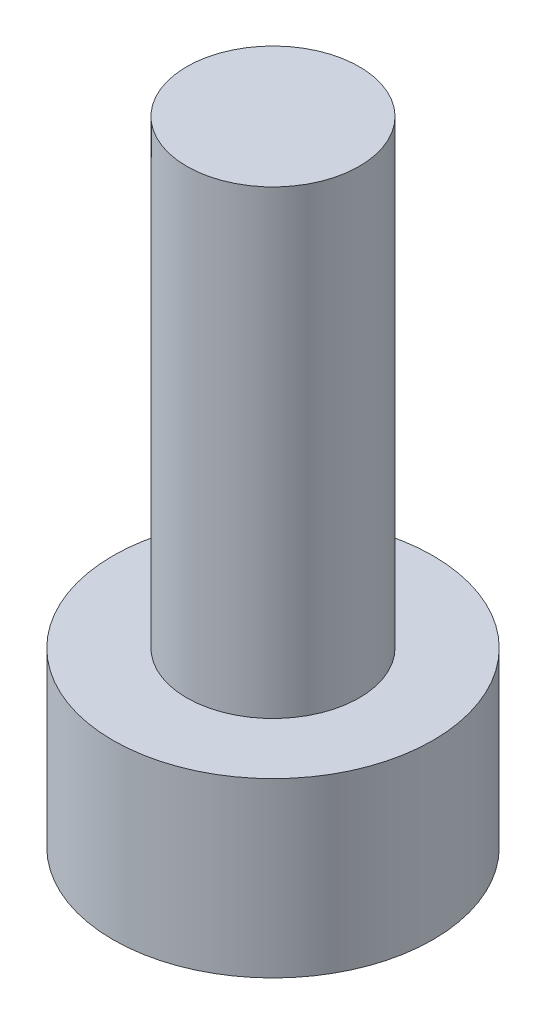
from build123d import *

# Parameters (mm, degrees)
SKETCH1_R           = 2.78
BOSS_EXTRUDE1_DEPTH = 3
SKETCH2_R           = 1.5
BOSS_EXTRUDE2_DEPTH = 8


with BuildPart() as part:
    # Sketch1 → Boss-Extrude1 (new body)
    with BuildSketch(Plane(origin=(0, 0, 0), x_dir=(1, 0, 0), z_dir=(0, 1, 0))):
        Circle(SKETCH1_R)
    extrude(amount=BOSS_EXTRUDE1_DEPTH)

    # Sketch2 → Boss-Extrude2 (add)
    with BuildSketch(Plane(origin=(0, 3, 0), x_dir=(1, 0, 0), z_dir=(0, 1, 0))):
        Circle(SKETCH2_R)
    extrude(amount=BOSS_EXTRUDE2_DEPTH)


solid = part.part
